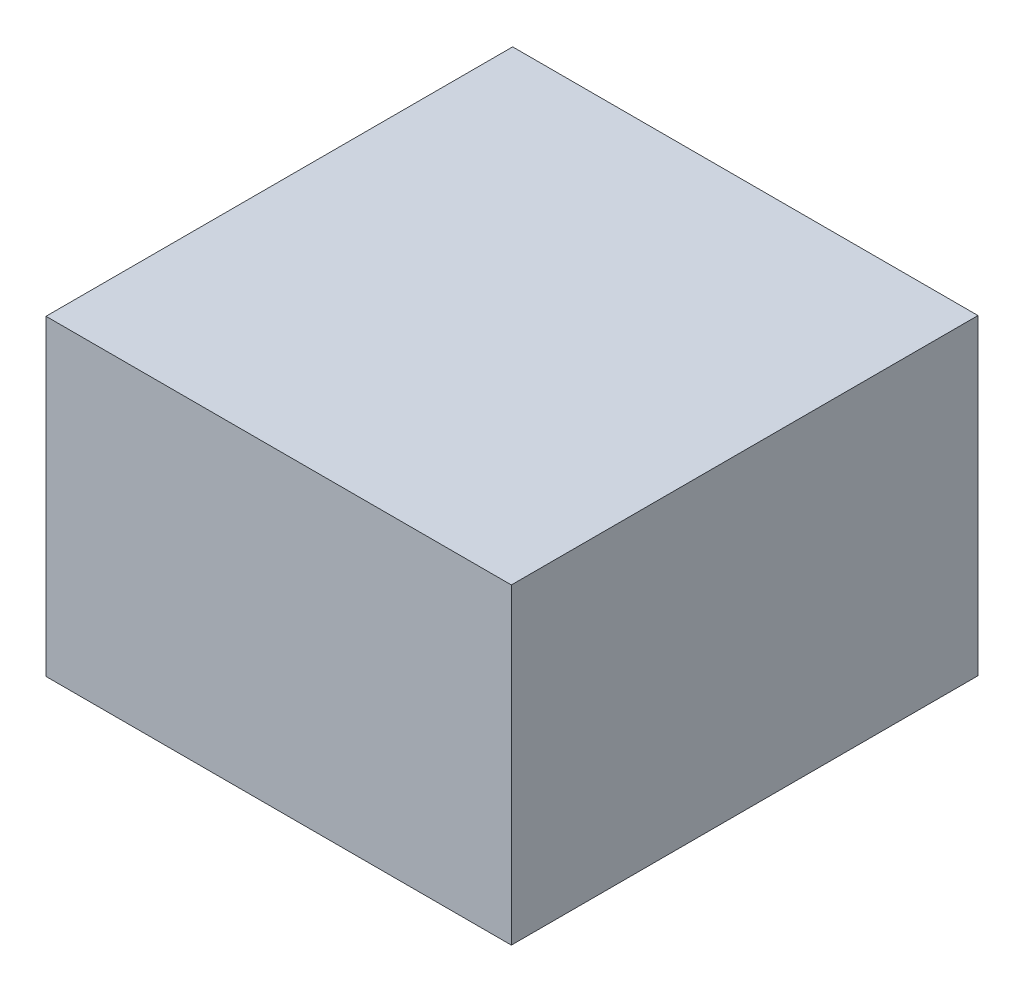
from build123d import *

# Parameters (mm, degrees)
SKETCH2_W           = 914.4
SKETCH2_H           = 609.6
BOSS_EXTRUDE1_DEPTH = 914.4
SHELL2_T            = 2.54
BOSS_EXTRUDE2_DEPTH = 76.2
CUT_EXTRUDE1_REACH  = 1186.038
SKETCH5_R           = 12.7
CUT_EXTRUDE2_DEPTH  = 50.8


with BuildPart() as part:
    # Sketch2 → Boss-Extrude1 (new body)
    with BuildSketch(Plane.XY):
        with Locations((0, 304.8)):
            Rectangle(SKETCH2_W, SKETCH2_H)
    extrude(amount=BOSS_EXTRUDE1_DEPTH)

    # Shell2
    shell2_openings = [part.faces().sort_by_distance(p)[0] for p in [
        (-457.2, 304.8, 457.2),
    ]]
    offset(amount=SHELL2_T, openings=shell2_openings, kind=Kind.INTERSECTION)

    # Sketch3 → Boss-Extrude2 (add)
    with BuildSketch(Plane.XZ.offset(-609.6)):
        Polygon((375.439658396, 755.983748909), (305.589658396, 635), (228.6, 679.45), (298.45, 800.433748909), align=None)
    extrude(amount=BOSS_EXTRUDE2_DEPTH)

    # Sketch4 → Cut-Extrude1 (cut, up to next)
    with BuildSketch(Plane(origin=(351.360480301, 0, 608.574203653), x_dir=(-0.8660254037844378, 0, 0.5000000000000017), z_dir=(-0.5000000000000016, 0, -0.8660254037844377)), mode=Mode.PRIVATE) as cut_extrude1_sk1:
        Polygon((115.713385542, 533.4), (52.851592695, 596.261792847), (52.851592695, 533.4), align=None)
    cut_extrude1_tool1 = extrude(cut_extrude1_sk1.sketch, amount=-CUT_EXTRUDE1_REACH, mode=Mode.PRIVATE) & part.part
    add(cut_extrude1_tool1.solids().sort_by_distance((287.443022, 554.353931, 645.476965))[0], mode=Mode.SUBTRACT)

    # Sketch5 → Cut-Extrude2 (cut)
    with BuildSketch(Plane(origin=(-281.074340908, 324.556692771, 162.278346386), x_dir=(-0.7905694150420981, -0.5477225575051634, -0.27386127875257926), z_dir=(0.6123724356957904, -0.7071067811865517, -0.3535533905932728))):
        with Locations((-751.823980575, -383.523111792)):
            Circle(SKETCH5_R)
    extrude(amount=-CUT_EXTRUDE2_DEPTH, mode=Mode.SUBTRACT)


solid = part.part
